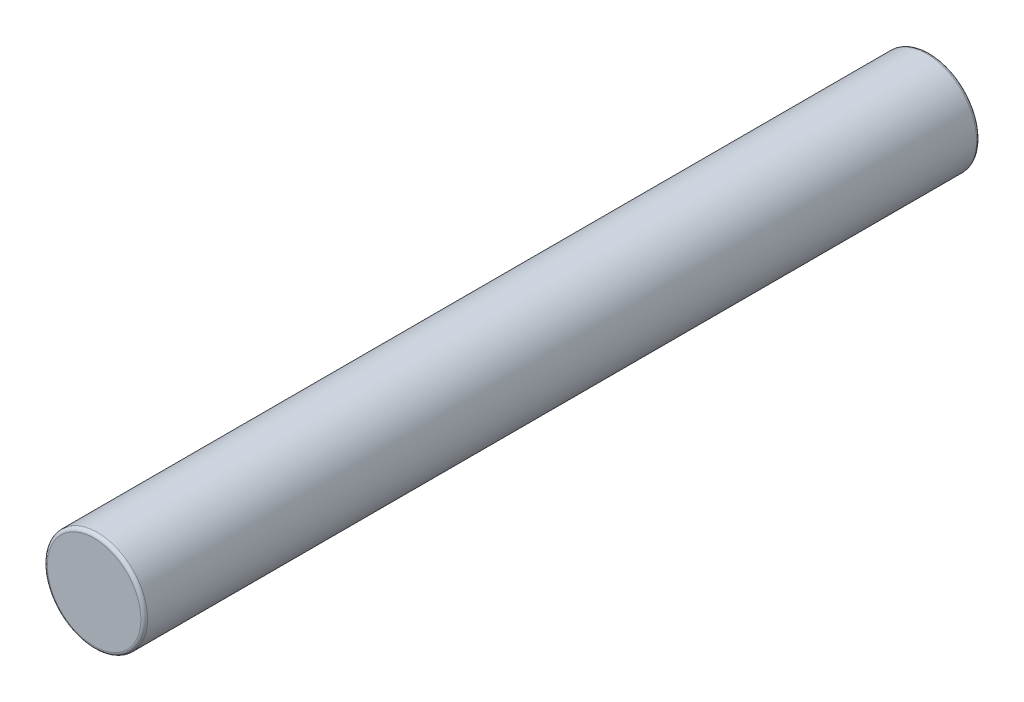
from build123d import *

# Parameters (mm, degrees)
SKETCH2_R           = 3
BOSS_EXTRUDE1_DEPTH = 50
FILLET1_R           = 0.2


with BuildPart() as part:
    # Sketch2 → Boss-Extrude1 (new body)
    with BuildSketch(Plane.XY):
        Circle(SKETCH2_R)
    extrude(amount=BOSS_EXTRUDE1_DEPTH)

    # Fillet1
    fillet1_edges = [part.edges().sort_by_distance(p)[0] for p in [
        (-3, 0, 0),
        (-3, 0, 50),
    ]]
    fillet(fillet1_edges, radius=FILLET1_R)


solid = part.part
